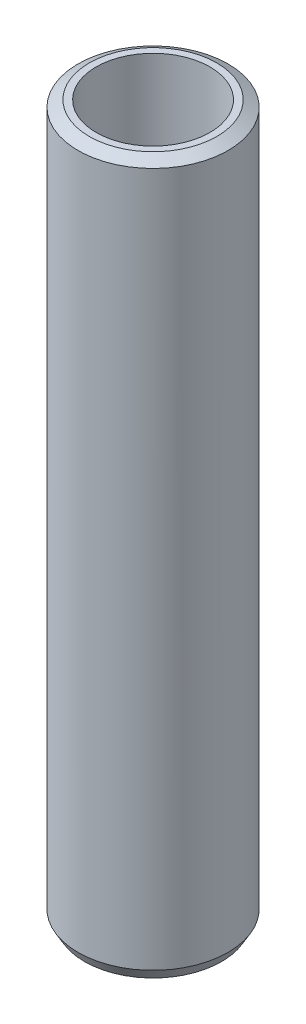
from build123d import *
from OCP.BRepFilletAPI import BRepFilletAPI_MakeChamfer

# Parameters (mm, degrees)
SKETCH1_R           = 50
BOSS_EXTRUDE1_DEPTH = 474.533639708
SKETCH2_R           = 37.90122339
CUT_EXTRUDE1_DEPTH  = 480.773045528
CHAMFER1_SIZE       = 4.337541877
CHAMFER1_SIZE2      = 7.512842912


with BuildPart() as part:
    # Sketch1 → Boss-Extrude1 (new body)
    with BuildSketch(Plane(origin=(0, 0, 0), x_dir=(1, 0, 0), z_dir=(0, 1, 0))):
        Circle(SKETCH1_R)
    extrude(amount=BOSS_EXTRUDE1_DEPTH)

    # Sketch2 → Cut-Extrude1 (cut, through all)
    with BuildSketch(Plane(origin=(0, 0, 0), x_dir=(1, 0, 0), z_dir=(0, 1, 0))):
        Circle(SKETCH2_R)
    extrude(amount=CUT_EXTRUDE1_DEPTH, mode=Mode.SUBTRACT)

    # Chamfer1: one chamfer whose edges measure the first distance from different faces: ONE call of the kernel's chamfer builder (chamfer() names one face for all edges)
    chamfer1_edges_1 = [part.edges().sort_by_distance(p)[0] for p in [
        (-50, 474.533639708, 0),
    ]]
    chamfer1_side_1 = [part.faces().sort_by_distance(p)[0] for p in [
        (-50, 237.266819854, 0),
    ]]
    chamfer1_edges_2 = [part.edges().sort_by_distance(p)[0] for p in [
        (-50, 0, 0),
    ]]
    chamfer1_side_2 = [part.faces().sort_by_distance(p)[0] for p in [
        (-48.585786438, 0, 0),
    ]]
    chamfer1 = BRepFilletAPI_MakeChamfer(part.part.solid().wrapped)
    for e in chamfer1_edges_1:
        chamfer1.Add(CHAMFER1_SIZE, CHAMFER1_SIZE2, e.wrapped, chamfer1_side_1[0].wrapped)  # the first distance lies on this face
    for e in chamfer1_edges_2:
        chamfer1.Add(CHAMFER1_SIZE, CHAMFER1_SIZE2, e.wrapped, chamfer1_side_2[0].wrapped)  # the first distance lies on this face
    add(Compound.cast(chamfer1.Shape()), mode=Mode.REPLACE)


solid = part.part
